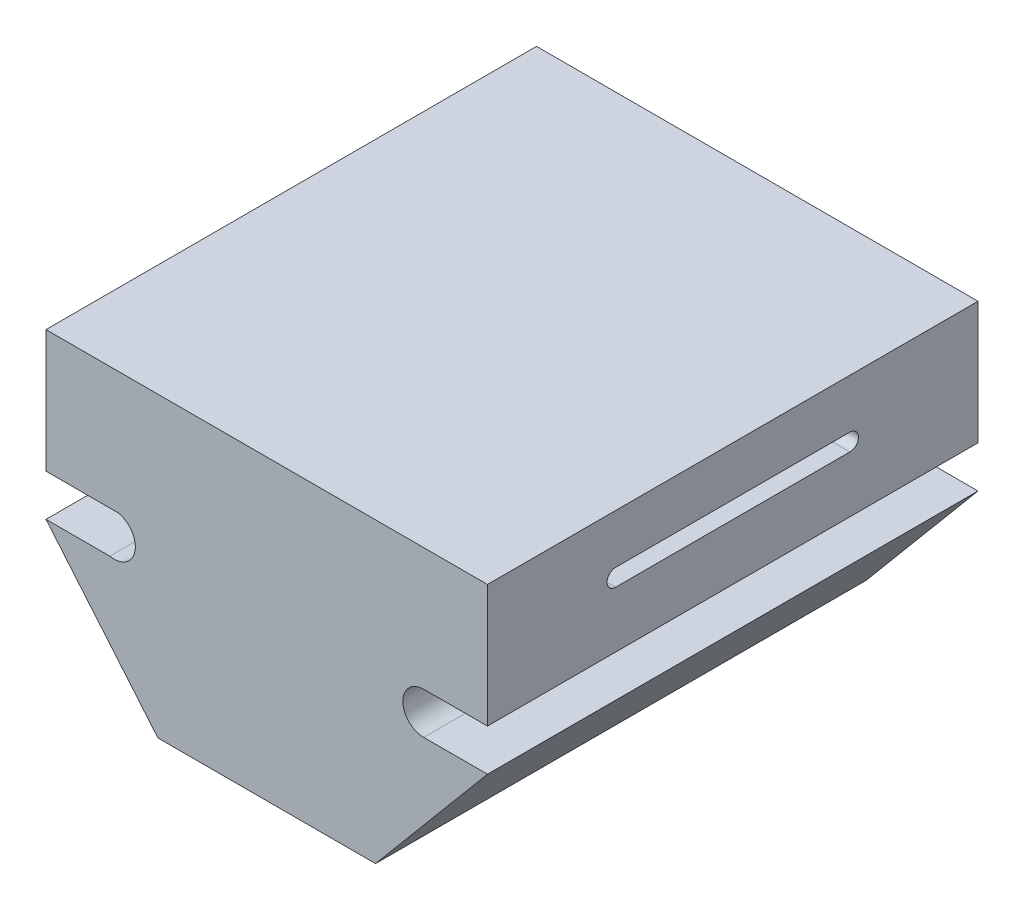
from build123d import *

# Parameters (mm, degrees)
BOSS_EXTRUDE3_DEPTH = 40
CUT_EXTRUDE1_DEPTH  = 72


with BuildPart() as part:
    # Sketch2 → Boss-Extrude3 (new body)
    with BuildSketch(Plane.XY):
        with BuildLine():
            Line((28.365517241, 10.268965517), (-7.634482759, 10.268965517))
            Line((-7.634482759, 10.268965517), (-7.634482759, 0.268965517))
            Line((-7.634482759, 0.268965517), (-1.734482759, 0.268965517))
            ThreePointArc((-1.734482759, 0.268965517), (-0.384482759, -1.781034483), (-2.434482759, -3.131034483))
            Line((-2.434482759, -3.131034483), (-7.634482759, -3.131034483))
            Line((-7.634482759, -3.131034483), (1.493101299, -14.008865575))
            Line((1.493101299, -14.008865575), (19.237933184, -14.008865575))
            Line((19.237933184, -14.008865575), (28.365517241, -3.131034483))
            Line((28.365517241, -3.131034483), (23.165517241, -3.131034483))
            ThreePointArc((23.165517241, -3.131034483), (21.465517241, -1.431034483), (23.165517241, 0.268965517))
            Line((23.165517241, 0.268965517), (28.365517241, 0.268965517))
            Line((28.365517241, 0.268965517), (28.365517241, 10.268965517))
        make_face()
    extrude(amount=BOSS_EXTRUDE3_DEPTH)

    # Sketch4 → Cut-Extrude1 (cut)
    with BuildSketch(Plane.ZY.offset(7.634482759)):
        with BuildLine():
            Line((10.45, 6.251111401), (29.55, 6.251111401))
            ThreePointArc((29.55, 6.251111401), (30.25, 5.551111401), (29.55, 4.851111401))
            Line((29.55, 4.851111401), (10.45, 4.851111401))
            ThreePointArc((10.45, 4.851111401), (9.75, 5.551111401), (10.45, 6.251111401))
        make_face()
    extrude(amount=-CUT_EXTRUDE1_DEPTH, mode=Mode.SUBTRACT)


solid = part.part
